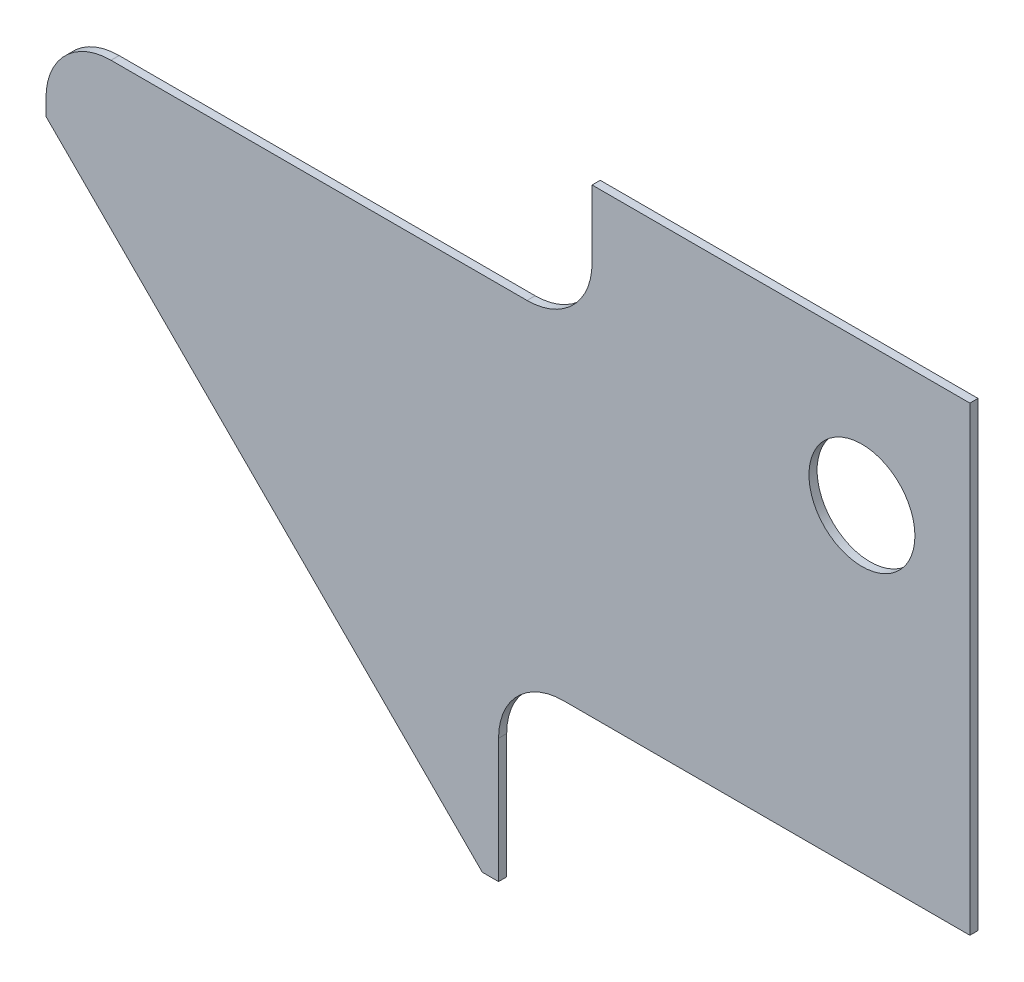
from build123d import *

# Parameters (mm, degrees)
SKETCH1_R           = 20.701
BOSS_EXTRUDE1_DEPTH = 3.175
SKETCH2_W           = 184.202806358
SKETCH2_H           = 73.914
CUT_EXTRUDE1_DEPTH  = 266.893552722
FILLET1_R           = 25.4
SKETCH4_W           = 213.36
SKETCH4_H           = 64.479988722
CUT_EXTRUDE2_DEPTH  = 266.893552722
FILLET2_R           = 25.4
SKETCH7_W           = 147.610011278
SKETCH7_H           = 12.7
CUT_EXTRUDE4_DEPTH  = 266.893552722


with BuildPart() as part:
    # Sketch1 → Boss-Extrude1 (new body)
    with BuildSketch(Plane.XY):
        Polygon((-138.259383474, 48.991487021), (32.210627804, -121.478524257), (222.710627804, -121.478524257), (222.710627804, 145.221475743), (-138.259383474, 145.221475743), align=None)
        with Locations((180.538014078, 76.831975743)):
            Circle(SKETCH1_R, mode=Mode.SUBTRACT)
    extrude(amount=BOSS_EXTRUDE1_DEPTH)

    # Sketch2 → Cut-Extrude1 (cut, through all)
    with BuildSketch(Plane.XY.offset(3.175)):
        with Locations((130.662030983, -84.521524257)):
            Rectangle(SKETCH2_W, SKETCH2_H)
    extrude(amount=-CUT_EXTRUDE1_DEPTH, mode=Mode.SUBTRACT)

    # Fillet1
    fillet1_edges = [part.edges().sort_by_distance(p)[0] for p in [
        (38.560627804, -47.564524257, 1.5875),
    ]]
    fillet(fillet1_edges, radius=FILLET1_R)

    # Sketch4 → Cut-Extrude2 (cut, through all)
    with BuildSketch(Plane.XY.offset(3.175)):
        with Locations((-31.579383474, 112.981481382)):
            Rectangle(SKETCH4_W, SKETCH4_H)
    extrude(amount=-CUT_EXTRUDE2_DEPTH, mode=Mode.SUBTRACT)

    # Fillet2
    fillet2_edges = [part.edges().sort_by_distance(p)[0] for p in [
        (-138.259383474, 80.741487021, 1.5875),
        (75.100616526, 80.741487021, 1.5875),
    ]]
    fillet(fillet2_edges, radius=FILLET2_R)

    # Sketch7 → Cut-Extrude4 (cut, through all)
    with BuildSketch(Plane.XY.offset(3.175)):
        with Locations((148.905622165, 138.871475743)):
            Rectangle(SKETCH7_W, SKETCH7_H)
    extrude(amount=-CUT_EXTRUDE4_DEPTH, mode=Mode.SUBTRACT)


solid = part.part
